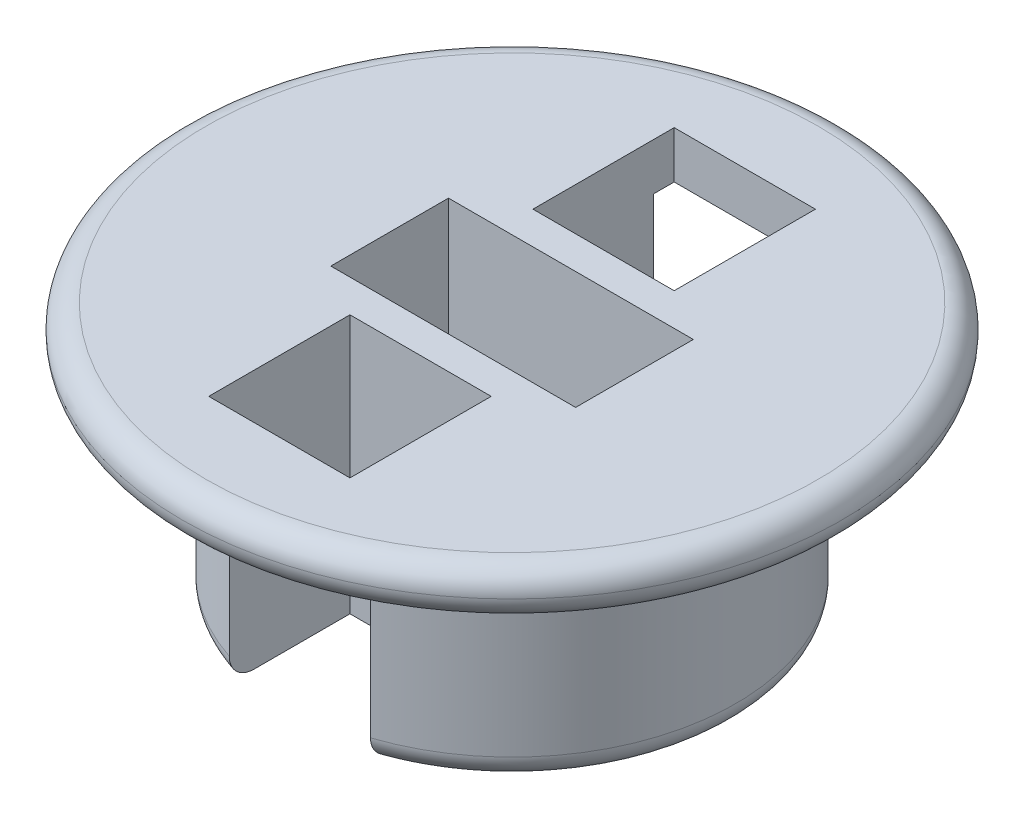
from build123d import *

# Parameters (mm, degrees)
SKETCH1_R           = 4.75
BOSS_EXTRUDE1_DEPTH = 4.5
SKETCH2_R           = 7
BOSS_EXTRUDE2_DEPTH = 1
SKETCH3_W           = 3
SKETCH3_H           = 3
CUT_EXTRUDE1_DEPTH  = 12.324751653
FILLET3_R           = 0.5
SKETCH4_W           = 5.2
SKETCH4_H           = 2.5
CUT_EXTRUDE2_DEPTH  = 12.324751763


with BuildPart() as part:
    # Sketch1 → Boss-Extrude1 (new body)
    with BuildSketch(Plane(origin=(0, 0, 0), x_dir=(1, 0, 0), z_dir=(0, 1, 0))):
        with Locations(Location((0, 0, 0), (0, 0, 270))):
            Circle(SKETCH1_R)
    extrude(amount=BOSS_EXTRUDE1_DEPTH)

    # Sketch2 → Boss-Extrude2 (add)
    with BuildSketch(Plane(origin=(0, 4.5, 0), x_dir=(1, 0, 0), z_dir=(0, 1, 0))):
        with Locations(Location((0, 0, 0), (0, 0, 270))):
            Circle(SKETCH2_R)
    extrude(amount=BOSS_EXTRUDE2_DEPTH)

    # Sketch3 → Cut-Extrude1 (cut, through all)
    with BuildSketch(Plane(origin=(0, 5.5, 0), x_dir=(1, 0, 0), z_dir=(0, 1, 0))):
        with Locations((0, 3.443002763)):
            Rectangle(SKETCH3_W, SKETCH3_H)
        with Locations((0, -3.443002763)):
            Rectangle(SKETCH3_W, SKETCH3_H)
    extrude(amount=-CUT_EXTRUDE1_DEPTH, mode=Mode.SUBTRACT)

    # Fillet3
    fillet3_edges = [part.edges().sort_by_distance(p)[0] for p in [
        (-4.75, 0, 0),
        (4.75, 0, 0),
        (0, 4.5, -7),
        (0, 5.5, -7),
    ]]
    fillet(fillet3_edges, radius=FILLET3_R - 0.0001)  # a hair under: the kernel refuses the full size

    # Sketch4 → Cut-Extrude2 (cut, through all)
    with BuildSketch(Plane(origin=(0, 5.5, 0), x_dir=(1, 0, 0), z_dir=(0, 1, 0))):
        Rectangle(SKETCH4_W, SKETCH4_H)
    extrude(amount=-CUT_EXTRUDE2_DEPTH, mode=Mode.SUBTRACT)


solid = part.part
